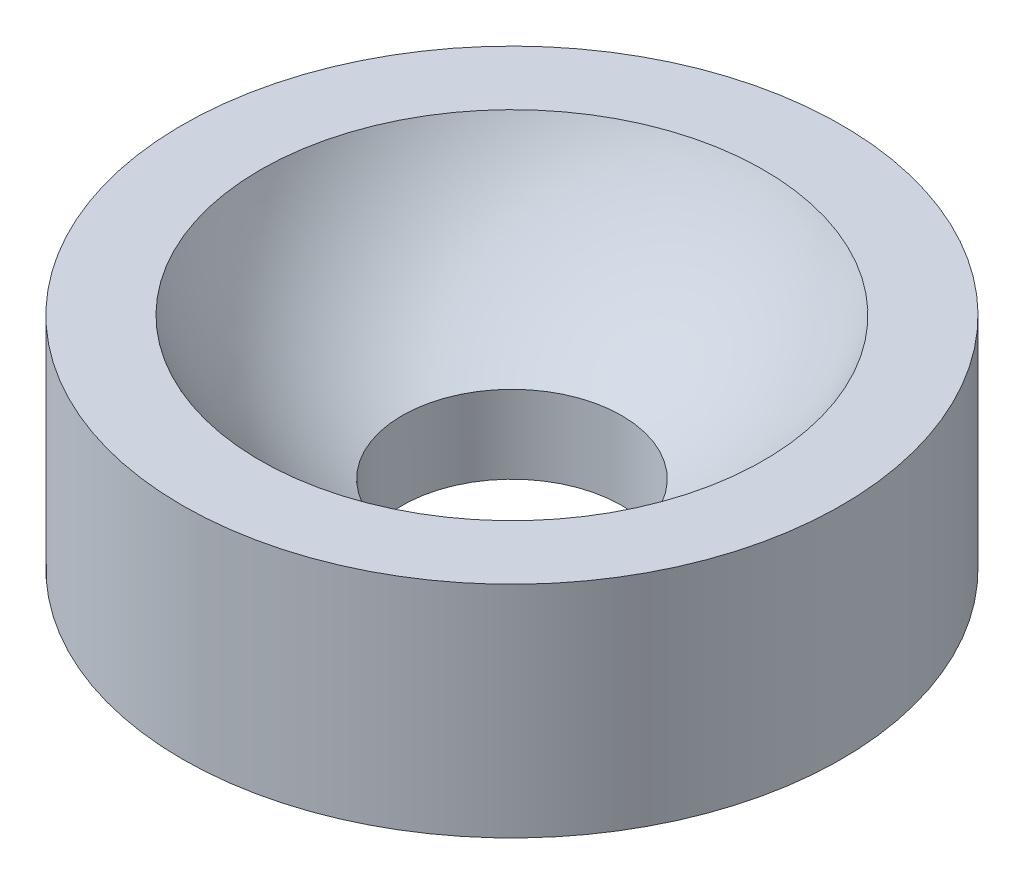
from build123d import *

# Parameters (mm, degrees)
SKETCH1_R           = 6
BOSS_EXTRUDE1_DEPTH = 4
SKETCH3_R           = 2
CUT_EXTRUDE1_DEPTH  = 4


with BuildPart() as part:
    # Sketch1 → Boss-Extrude1 (new body)
    with BuildSketch(Plane(origin=(0, 0, 0), x_dir=(1, 0, 0), z_dir=(0, 1, 0))):
        Circle(SKETCH1_R)
    extrude(amount=BOSS_EXTRUDE1_DEPTH)

    # Sketch2 → Cut-Revolve1 (revolve, cut)
    with BuildSketch(Plane.XY):
        with BuildLine():
            Line((0, 1), (0, 11))
            ThreePointArc((0, 11), (5, 6), (0, 1))
        make_face()
    revolve(axis=Axis((0, 1, 0), (0, 1, 0)), mode=Mode.SUBTRACT)

    # Sketch3 → Cut-Extrude1 (cut)
    with BuildSketch(Plane.XZ):
        Circle(SKETCH3_R)
    extrude(amount=-CUT_EXTRUDE1_DEPTH, mode=Mode.SUBTRACT)


solid = part.part
